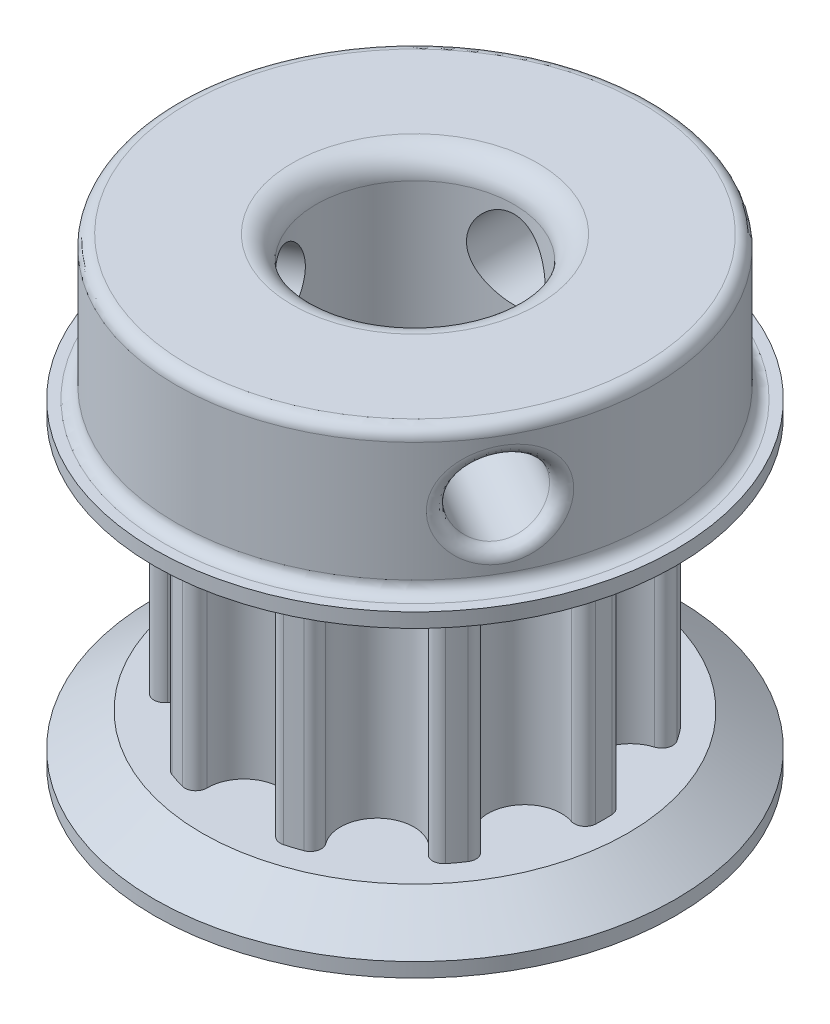
from build123d import *
from OCP.BRepFilletAPI import BRepFilletAPI_MakeChamfer

# Parameters (mm, degrees)
BOSS_EXTRU_1_DEPTH           = 9.3
R_P_TITION_CIRCULAIRE1_COUNT = 10
ESQUISSE2_R                  = 10.925130477
BOSS_EXTRU_2_DEPTH           = 2
CHANFREIN1_SIZE              = 2
CHANFREIN1_SIZE2             = 1.400415076
ESQUISSE4_R                  = 10
BOSS_EXTRU_3_DEPTH           = 6
ESQUISSE5_R                  = 1.65
ENL_V_MAT_EXTRU_2_DEPTH      = 24.194976867
R_P_TITION_CIRCULAIRE2_COUNT = 3
ENL_V_MAT_EXTRU_1_REACH      = 26.723
ESQUISSE3_R                  = 4.15
CONG_1_R                     = 1
CONG_2_R                     = 0.5


with BuildPart() as part:
    # Esquisse1 → Boss.-Extru.1 (new body)
    with BuildSketch(Plane(origin=(0, 0, 0), x_dir=(1, 0, 0), z_dir=(0, 1, 0))):
        with BuildLine():
            Line((0, 0), (-2.449, 7.537246983))
            ThreePointArc((-2.449, 7.537246983), (-2.286802769, 7.588031772), (-2.123553773, 7.635326611))
            ThreePointArc((-2.123553773, 7.635326611), (-1.721383845, 7.556942144), (-1.5428703, 7.188136381))
            ThreePointArc((-1.5428703, 7.188136381), (0, 5.625130477), (1.5428703, 7.188136381))
            ThreePointArc((1.5428703, 7.188136381), (1.721383845, 7.556942144), (2.123553773, 7.635326611))
            ThreePointArc((2.123553773, 7.635326611), (2.286802769, 7.588031772), (2.449, 7.537246983))
            Line((2.449, 7.537246983), (0, 0))
        make_face()
    boss_extru_1 = extrude(amount=BOSS_EXTRU_1_DEPTH)

    # Répétition circulaire1: Boss.-Extru.1 ×10 about axis
    r_p_tition_circulaire1_axis = Axis((0, 9.3, 0), (0, -1, 0))
    for i in range(1, R_P_TITION_CIRCULAIRE1_COUNT):
        add(boss_extru_1.rotate(r_p_tition_circulaire1_axis, i * 360 / R_P_TITION_CIRCULAIRE1_COUNT))

    # Esquisse2 → Boss.-Extru.2 (add)
    with BuildSketch(Plane(origin=(0, 9.3, 0), x_dir=(1, 0, 0), z_dir=(0, 1, 0))):
        Circle(ESQUISSE2_R)
    boss_extru_2 = extrude(amount=BOSS_EXTRU_2_DEPTH)

    # Symétrie1: Boss.-Extru.2 across plane
    add(boss_extru_2.mirror(Plane(origin=(0, 4.65, 0), x_dir=(0, 0, 1), z_dir=(0, -1, 0))))

    # Chanfrein1: one chamfer whose edges measure the first distance from different faces: ONE call of the kernel's chamfer builder (chamfer() names one face for all edges)
    chanfrein1_edges_1 = [part.edges().sort_by_distance(p)[0] for p in [
        (-10.925130477, 9.3, 0),
    ]]
    chanfrein1_side_1 = [part.faces().sort_by_distance(p)[0] for p in [
        (-10.616121123, 9.3, 0),
    ]]
    chanfrein1_edges_2 = [part.edges().sort_by_distance(p)[0] for p in [
        (-10.925130477, 0, 0),
    ]]
    chanfrein1_side_2 = [part.faces().sort_by_distance(p)[0] for p in [
        (-10.616121123, 0, 0),
    ]]
    chanfrein1 = BRepFilletAPI_MakeChamfer(part.part.solid().wrapped)
    for e in chanfrein1_edges_1:
        chanfrein1.Add(CHANFREIN1_SIZE, CHANFREIN1_SIZE2, e.wrapped, chanfrein1_side_1[0].wrapped)  # the first distance lies on this face
    for e in chanfrein1_edges_2:
        chanfrein1.Add(CHANFREIN1_SIZE, CHANFREIN1_SIZE2, e.wrapped, chanfrein1_side_2[0].wrapped)  # the first distance lies on this face
    add(Compound.cast(chanfrein1.Shape()), mode=Mode.REPLACE)

    # Esquisse4 → Boss.-Extru.3 (add)
    with BuildSketch(Plane(origin=(0, 11.3, 0), x_dir=(1, 0, 0), z_dir=(0, 1, 0))):
        Circle(ESQUISSE4_R)
    extrude(amount=BOSS_EXTRU_3_DEPTH)

    # Esquisse5 → Enlèv. mat.-Extru.2 (cut, through all)
    with BuildSketch(Plane.XY):
        with Locations((0, 14.3)):
            Circle(ESQUISSE5_R)
    enl_v_mat_extru_2 = extrude(amount=-ENL_V_MAT_EXTRU_2_DEPTH, mode=Mode.SUBTRACT)

    # Répétition circulaire2: Enlèv. mat.-Extru.2 ×3 about axis
    r_p_tition_circulaire2_axis = Axis((0, 17.3, 0), (0, -1, 0))
    for i in range(1, R_P_TITION_CIRCULAIRE2_COUNT):
        add(enl_v_mat_extru_2.rotate(r_p_tition_circulaire2_axis, i * 360 / R_P_TITION_CIRCULAIRE2_COUNT), mode=Mode.SUBTRACT)

    # Esquisse3 → Enlèv. mat.-Extru.1 (cut, up to next)
    with BuildSketch(Plane(origin=(0, 17.3, 0), x_dir=(1, 0, 0), z_dir=(0, 1, 0)), mode=Mode.PRIVATE) as enl_v_mat_extru_1_sk1:
        Circle(ESQUISSE3_R)
    enl_v_mat_extru_1_tool1 = extrude(enl_v_mat_extru_1_sk1.sketch, amount=-ENL_V_MAT_EXTRU_1_REACH, mode=Mode.PRIVATE) & part.part
    add(enl_v_mat_extru_1_tool1.solids().sort_by_distance((0, 17.3, 0))[0], mode=Mode.SUBTRACT)

    # Congé1
    cong_1_edges = [part.edges().sort_by_distance(p)[0] for p in [
        (-4.15, -2, 0),
        (-4.15, 17.3, 0),
    ]]
    fillet(cong_1_edges, radius=CONG_1_R)

    # Congé2
    cong_2_edges = [part.edges().sort_by_distance(p)[0] for p in [
        (-10, 11.3, 0),
        (-10, 17.3, 0),
        (-1.650000023, 14.300000005, -9.862935666),
        (-7.716552831, 14.300000005, 6.360409769),
        (9.366552854, 14.300000005, 3.502525897),
    ]]
    fillet(cong_2_edges, radius=CONG_2_R)


solid = part.part
